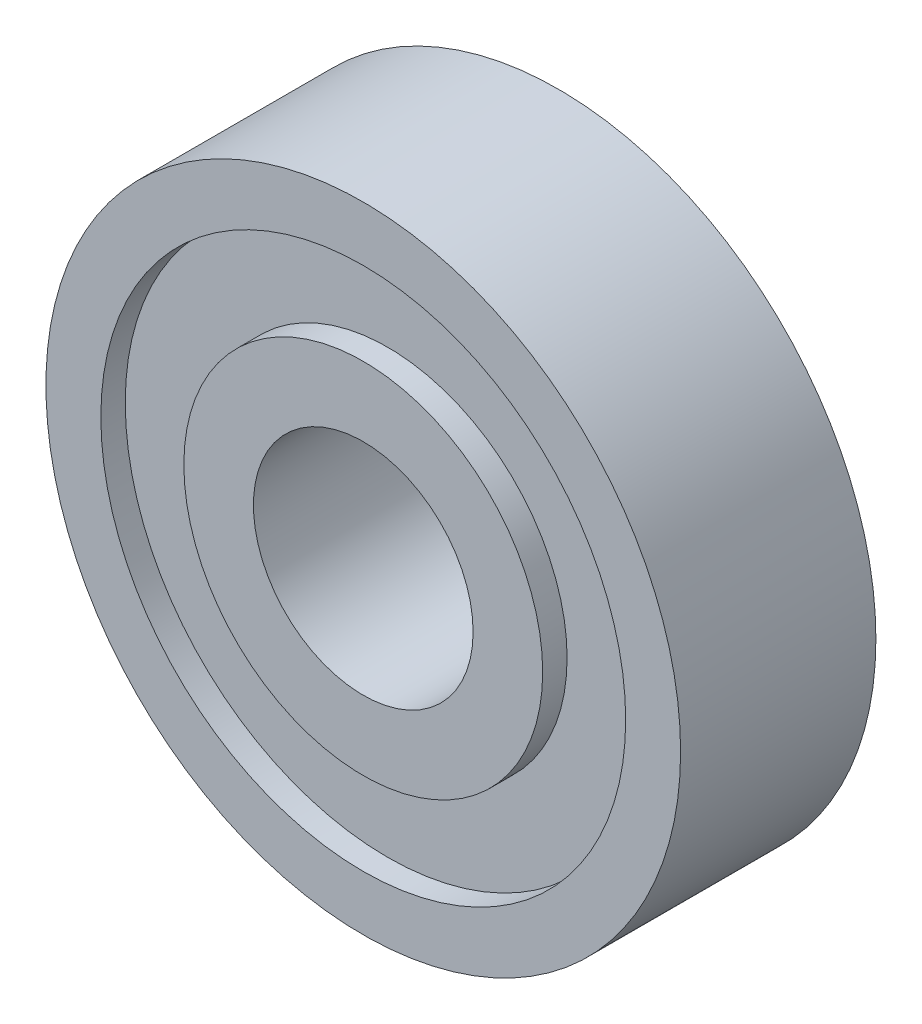
from build123d import *

# Parameters (mm, degrees)
SKETCH_1_R          = 13
SKETCH_1_R_2        = 4.5
EXTRUDE_1_DEPTH     = 8
SKETCH_2_R          = 10.75
SKETCH_2_R_2        = 7.35
CUT_EXTRUDE_1_DEPTH = 1
CUT_EXTRUDE_START   = -1
SKETCH_3_R          = 10.75
SKETCH_3_R_2        = 7.35
CUT_EXTRUDE_2_DEPTH = 1


with BuildPart() as part:
    # Эскиз1 → Бобышка-Вытянуть1 (new body)
    with BuildSketch(Plane.XY):
        Circle(SKETCH_1_R)
        Circle(SKETCH_1_R_2, mode=Mode.SUBTRACT)
    extrude(amount=EXTRUDE_1_DEPTH)

    # Эскиз2 → Вырез-Вытянуть1 (cut)
    with BuildSketch(Plane.XY.offset(8)):
        Circle(SKETCH_2_R)
        Circle(SKETCH_2_R_2, mode=Mode.SUBTRACT)
    extrude(amount=-CUT_EXTRUDE_1_DEPTH, mode=Mode.SUBTRACT)

    # Эскиз3 → Вырез-Вытянуть2 (cut)
    with BuildSketch(Plane(origin=(0, 0, 0), x_dir=(-1, 0, 0), z_dir=(0, 0, -1)).offset(CUT_EXTRUDE_START)):
        Circle(SKETCH_3_R)
        Circle(SKETCH_3_R_2, mode=Mode.SUBTRACT)
    extrude(amount=CUT_EXTRUDE_2_DEPTH, mode=Mode.SUBTRACT)


solid = part.part
